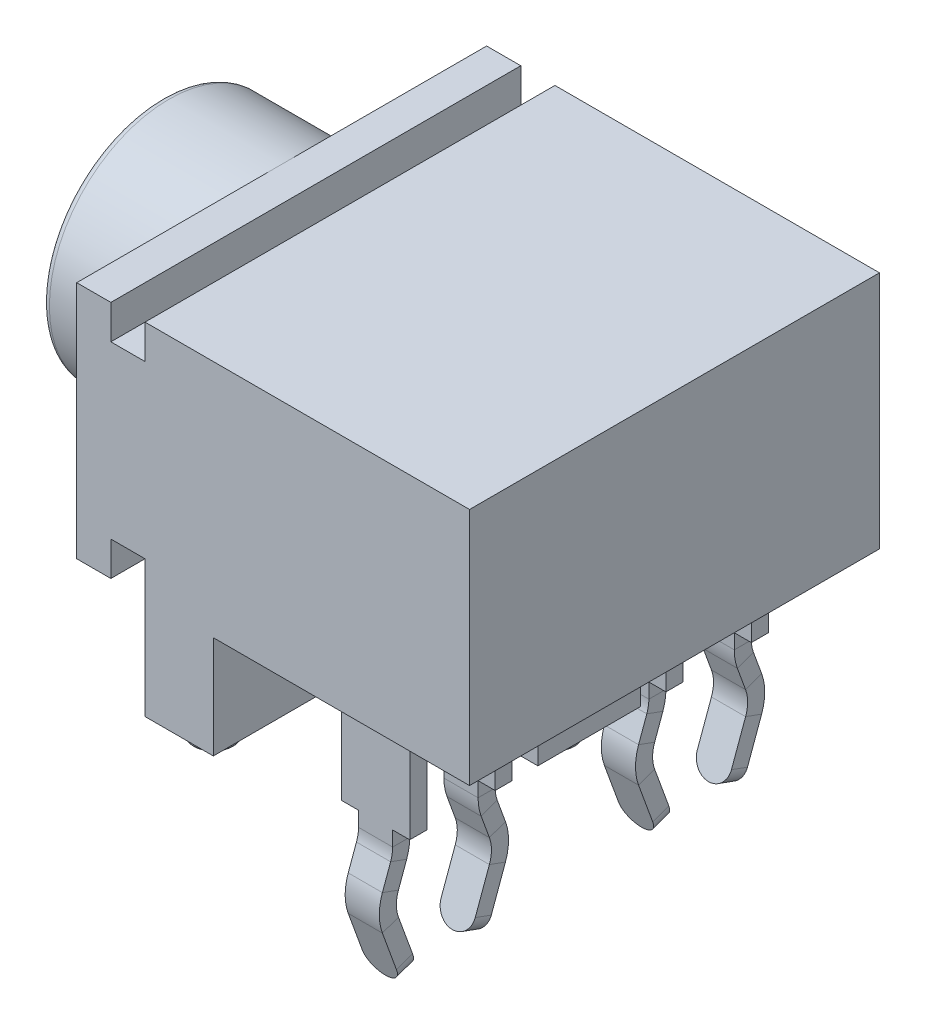
from build123d import *

# Parameters (mm, degrees)
SKETCH1_W              = 11.5
SKETCH1_H              = 12
EXTRUDE_1195_DEPTH     = 10
SKETCH4_R              = 3.5
SKETCH4_R_2            = 1.8
EXTRUDE_1407_DEPTH     = 3.5
FILLET_2_R             = 0.2
SKETCH_4_W             = 1
SKETCH_4_H             = 12
CUT_EXTRUDE_1856_DEPTH = 1
SKETCH_12_W            = 2
SKETCH_12_H            = 12
CUT_EXTRUDE_2188_DEPTH = 3
CUT_EXTRUDE_2633_DEPTH = 3
SKETCH_20_W            = 1
SKETCH_20_H            = 12
CUT_EXTRUDE_2_DEPTH    = 1
SKETCH3_R              = 0.6
EXTRUDE_3429_DEPTH     = 0.5
FILLET_4_R             = 0.1
SM_BASE_FLANGE_1_DEPTH = 0.5
OTHER_START            = 4.5
OTHER_8_DEPTH          = 1
OTHER_8_2_DEPTH        = 1
OTHER_9_DEPTH          = 1
OTHER_9_2_DEPTH        = 1
FILLET_5_R             = 0.499
SKETCH_42_W            = 0.5
SKETCH_42_H            = 4
SM_BASE_FLANGE_3_DEPTH = 1
OTHER_START_2          = -0.25
OTHER_19_DEPTH         = 0.5
OTHER_19_2_DEPTH       = 0.5
OTHER_20_DEPTH         = 0.5
OTHER_20_2_DEPTH       = 0.5
FILLET_6_R             = 0.499


# Read off the part's stored shape, not the designer's step: Нарисованный сгиб8, Нарисованный сгиб9, Нарисованный сгиб19, Нарисованный сгиб20
# Sheet-metal steps are written as plain solids
with BuildPart() as part:
    # Sketch1 → Extrude 1195 (new body)
    with BuildSketch(Plane(origin=(0, 0, 0), x_dir=(1, 0, 0), z_dir=(0, 1, 0))):
        with Locations((2.75, 0)):
            Rectangle(SKETCH1_W, SKETCH1_H)
    extrude(amount=EXTRUDE_1195_DEPTH)

    # Sketch4 → Extrude 1407 (add)
    with BuildSketch(Plane(origin=(-3, 0, 0), x_dir=(0, 0, -1), z_dir=(1, 0, 0))):
        with Locations((0, 6.5)):
            Circle(SKETCH4_R)
        with Locations((0, 6.5)):
            Circle(SKETCH4_R_2, mode=Mode.SUBTRACT)
    extrude(amount=-EXTRUDE_1407_DEPTH)

    # Скругление2
    fillet_2_edges = [part.edges().sort_by_distance(p)[0] for p in [
        (-6.5, 6.5, 3.5),
        (-6.5, 6.5, 1.8),
    ]]
    fillet(fillet_2_edges, radius=FILLET_2_R)

    # Эскиз4 → Cut-Extrude 1856 (cut)
    with BuildSketch(Plane(origin=(0, 10, 0), x_dir=(1, 0, 0), z_dir=(0, 1, 0))):
        with Locations((-1.5, 0)):
            Rectangle(SKETCH_4_W, SKETCH_4_H)
    extrude(amount=-CUT_EXTRUDE_1856_DEPTH, mode=Mode.SUBTRACT)

    # Эскиз12 → Cut-Extrude 2188 (cut)
    with BuildSketch(Plane.XZ):
        with Locations((-2, 0)):
            Rectangle(SKETCH_12_W, SKETCH_12_H)
    extrude(amount=-CUT_EXTRUDE_2188_DEPTH, mode=Mode.SUBTRACT)

    # Эскиз13 → Cut-Extrude 2633 (cut)
    with BuildSketch(Plane.XZ):
        Polygon((1, -6), (8.5, -6), (8.5, 6), (1, 6), (1, 1.5), (6, 1.5), (6, -1.5), (1, -1.5), align=None)
    extrude(amount=-CUT_EXTRUDE_2633_DEPTH, mode=Mode.SUBTRACT)

    # Эскиз20 → Нижний паз 2 (cut)
    with BuildSketch(Plane.XZ.offset(-3)):
        with Locations((-1.5, 0)):
            Rectangle(SKETCH_20_W, SKETCH_20_H)
    extrude(amount=-CUT_EXTRUDE_2_DEPTH, mode=Mode.SUBTRACT)

    # Sketch3 → Extrude 3429 (add)
    with BuildSketch(Plane.XZ):
        with Locations(Location((0, 5, 0), (0, 0, 90))):
            Circle(SKETCH3_R)
        with Locations(Location((5, 0, 0), (0, 0, 90))):
            Circle(SKETCH3_R)
        with Locations(Location((0, -5, 0), (0, 0, 90))):
            Circle(SKETCH3_R)
    extrude(amount=EXTRUDE_3429_DEPTH)

    # Скругление4
    fillet_4_edges = [part.edges().sort_by_distance(p)[0] for p in [
        (0, -0.5, 4.4),
        (5, -0.5, -0.6),
        (0, -0.5, -5.6),
    ]]
    fillet(fillet_4_edges, radius=FILLET_4_R)


with BuildPart() as body_2:
    # Эскиз23 → Базовая кромка1 (new body)
    with BuildSketch(Plane.XY.offset(4.75)):
        Polygon((4, 3), (4, 0), (4.5, 0), (4.5, -4), (5.5, -4), (5.5, 0), (6, 0), (6, 3), align=None)
    extrude(amount=SM_BASE_FLANGE_1_DEPTH)

    # Other 8 outline → Other 8 (cut)
    with BuildSketch(Plane.YZ.offset(OTHER_START)):
        with BuildLine():
            ThreePointArc((-0.434210549, 4.75), (-0.694682816, 4.77278837), (-0.947240764, 4.840461069))
            Line((-0.947240764, 4.840461069), (-2.07243973, 5.25))
            Line((-2.07243973, 5.25), (-4, 5.25))
            Line((-4, 5.25), (-4, 4.75))
            Line((-4, 4.75), (-0.434210549, 4.75))
        make_face()
    extrude(amount=OTHER_8_DEPTH, mode=Mode.SUBTRACT)

    # Other 8 2 outline → Other 8 2 (add)
    with BuildSketch(Plane.YZ.offset(OTHER_START)):
        with BuildLine():
            Line((-3.937170734, 5.92870658), (-2.07243973, 5.25))
            Line((-2.07243973, 5.25), (-0.434210549, 5.25))
            ThreePointArc((-0.434210549, 5.25), (-0.607858727, 5.265192247), (-0.776230693, 5.310307379))
            Line((-0.776230693, 5.310307379), (-3.766160663, 6.398552891))
            Line((-3.766160663, 6.398552891), (-3.937170734, 5.92870658))
        make_face()
    extrude(amount=OTHER_8_2_DEPTH)

    # Other 9 outline → Other 9 (cut)
    with BuildSketch(Plane.YZ.offset(OTHER_START)):
        with BuildLine():
            ThreePointArc((-2.464204349, 5.551224091), (-1.951174134, 5.64168516), (-1.438143919, 5.551224091))
            Line((-1.438143919, 5.551224091), (-3.766160663, 6.398552891))
            Line((-3.766160663, 6.398552891), (-3.937170734, 5.92870658))
            Line((-3.937170734, 5.92870658), (-2.682125234, 5.471907376))
            Line((-2.682125234, 5.471907376), (-2.464204349, 5.551224091))
        make_face()
    extrude(amount=OTHER_9_DEPTH, mode=Mode.SUBTRACT)

    # Other 9 2 outline → Other 9 2 (add)
    with BuildSketch(Plane.YZ.offset(OTHER_START)):
        with BuildLine():
            Line((-1.609153991, 5.081377781), (-2.682125234, 5.471907376))
            Line((-2.682125234, 5.471907376), (-4.070588964, 4.966547907))
            Line((-4.070588964, 4.966547907), (-3.899578893, 4.496701596))
            Line((-3.899578893, 4.496701596), (-2.293194277, 5.081377781))
            ThreePointArc((-2.293194277, 5.081377781), (-1.951174134, 5.14168516), (-1.609153991, 5.081377781))
        make_face()
    extrude(amount=OTHER_9_2_DEPTH)

    # Скругление5
    fillet_5_edges = [body_2.edges().sort_by_distance(p)[0] for p in [
        (4.5, -3.985083928, 4.731624752),
        (5.5, -3.985083928, 4.731624752),
    ]]
    fillet(fillet_5_edges, radius=FILLET_5_R)


with BuildPart() as body_3:
    # Зеркальное отражение1: mirrored copy
    add(body_2.part.mirror(Plane.XY.offset(3.75)))


with BuildPart() as body_4:
    # Зеркальное отражение2: mirrored copy
    add(body_2.part.mirror(Plane.XY))


with BuildPart() as body_5:
    # Mirror 2 2: mirrored copy
    add(body_3.part.mirror(Plane.XY))


with BuildPart() as body_6:
    # Эскиз42 → Базовая кромка3 (new body)
    with BuildSketch(Plane(origin=(0.5, 0, 0), x_dir=(0, 0, -1), z_dir=(1, 0, 0))):
        with Locations((0, -2)):
            Rectangle(SKETCH_42_W, SKETCH_42_H)
    extrude(amount=-SM_BASE_FLANGE_3_DEPTH)

    # Other 19 outline → Other 19 (cut)
    with BuildSketch(Plane.XY.offset(OTHER_START_2)):
        with BuildLine():
            Line((0.454423259, -0.738227417), (-0.120715252, -4))
            Line((-0.120715252, -4), (0.5, -4))
            Line((0.5, -4), (0.5, -0.217282884))
            ThreePointArc((0.5, -0.217282884), (0.488584094, -0.478750112), (0.454423259, -0.738227417))
        make_face()
    extrude(amount=OTHER_19_DEPTH, mode=Mode.SUBTRACT)

    # Other 19 2 outline → Other 19 2 (add)
    with BuildSketch(Plane.XY.offset(OTHER_START_2)):
        with BuildLine():
            ThreePointArc((-0.5, -0.217282884), (-0.507610604, -0.391594369), (-0.530384494, -0.564579239))
            Line((-0.530384494, -0.564579239), (-1.120570314, -3.911689351))
            Line((-1.120570314, -3.911689351), (-0.135762561, -4.085337529))
            Line((-0.135762561, -4.085337529), (-0.120715252, -4))
            Line((-0.120715252, -4), (-0.5, -4))
            Line((-0.5, -4), (-0.5, -0.217282884))
        make_face()
    extrude(amount=OTHER_19_2_DEPTH)

    # Other 20 outline → Other 20 (cut)
    with BuildSketch(Plane.XY.offset(OTHER_START_2)):
        with BuildLine():
            ThreePointArc((-0.590117837, -3.217930711), (-0.759624069, -2.453337509), (-0.725463234, -1.670925748))
            Line((-0.725463234, -1.670925748), (-1.120570314, -3.911689351))
            Line((-1.120570314, -3.911689351), (-0.283915714, -4.059214131))
            Line((-0.283915714, -4.059214131), (-0.590117837, -3.217930711))
        make_face()
    extrude(amount=OTHER_20_DEPTH, mode=Mode.SUBTRACT)

    # Other 20 2 outline → Other 20 2 (add)
    with BuildSketch(Plane.XY.offset(OTHER_START_2)):
        with BuildLine():
            Line((-0.135762561, -4.085337529), (-0.283915714, -4.059214131))
            Line((-0.283915714, -4.059214131), (-0.205887727, -4.273594263))
            Line((-0.205887727, -4.273594263), (0.733804894, -3.93157412))
            Line((0.733804894, -3.93157412), (0.349574784, -2.875910568))
            ThreePointArc((0.349574784, -2.875910568), (0.236570629, -2.366181767), (0.259344519, -1.844573926))
            Line((0.259344519, -1.844573926), (-0.135762561, -4.085337529))
        make_face()
    extrude(amount=OTHER_20_2_DEPTH)

    # Скругление6
    fillet_6_edges = [body_6.edges().sort_by_distance(p)[0] for p in [
        (-0.205887727, -4.273594263, 0),
        (0.733804894, -3.93157412, 0),
    ]]
    fillet(fillet_6_edges, radius=FILLET_6_R)


solid = Compound([part.part, body_2.part, body_3.part, body_4.part, body_5.part, body_6.part])
